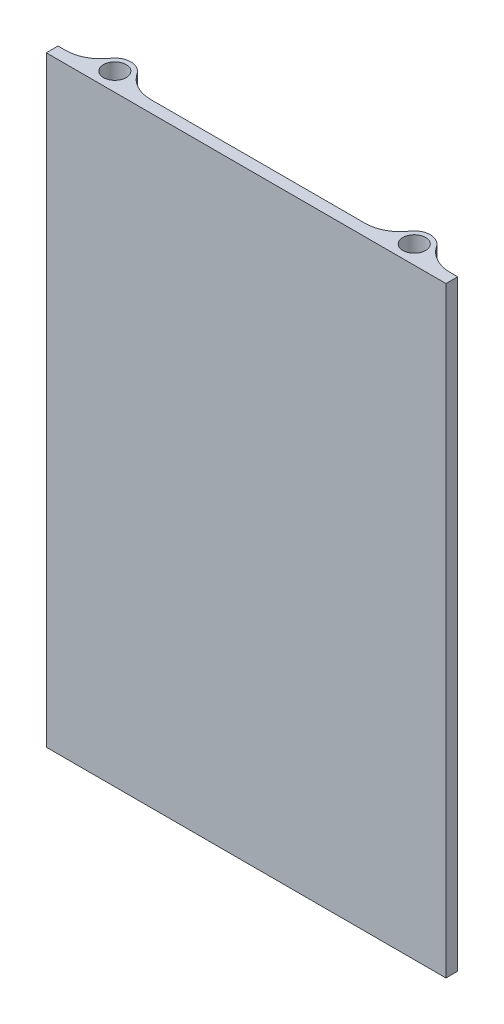
from build123d import *

# Parameters (mm, degrees)
SKETCH1_R           = 4.825
BOSS_EXTRUDE1_DEPTH = 255.8


with BuildPart() as part:
    # Sketch1 → Boss-Extrude1 (new body)
    with BuildSketch(Plane(origin=(0, 0, 0), x_dir=(1, 0, 0), z_dir=(0, 1, 0))):
        with BuildLine():
            Line((85, -5), (85, 0))
            Line((85, 0), (81.7968906, 0))
            ThreePointArc((81.7968906, 0), (74.742243816, 1.762479131), (69.345419397, 6.635738832))
            ThreePointArc((69.345419397, 6.635738832), (63.68, 9.655), (58.014580603, 6.635738832))
            ThreePointArc((58.014580603, 6.635738832), (52.617756184, 1.762479131), (45.5631094, 0))
            Line((45.5631094, 0), (-45.5631094, 0))
            ThreePointArc((-45.5631094, 0), (-52.617756184, 1.762479131), (-58.014580603, 6.635738832))
            ThreePointArc((-58.014580603, 6.635738832), (-63.68, 9.655), (-69.345419397, 6.635738832))
            ThreePointArc((-69.345419397, 6.635738832), (-74.742243816, 1.762479131), (-81.7968906, 0))
            Line((-81.7968906, 0), (-85, 0))
            Line((-85, 0), (-85, -5))
            Line((-85, -5), (85, -5))
        make_face()
        with Locations((-63.68, 2.83)):
            Circle(SKETCH1_R, mode=Mode.SUBTRACT)
        with Locations((63.68, 2.83)):
            Circle(SKETCH1_R, mode=Mode.SUBTRACT)
    extrude(amount=BOSS_EXTRUDE1_DEPTH)


solid = part.part
